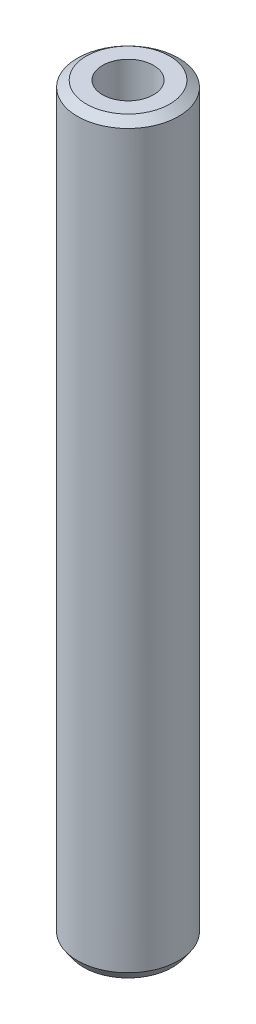
from build123d import *
from OCP.BRepFilletAPI import BRepFilletAPI_MakeChamfer

# Parameters (mm, degrees)
SKETCH1_R           = 5
BOSS_EXTRUDE1_DEPTH = 73.81651233
SKETCH2_R           = 2.522600989
CUT_EXTRUDE1_DEPTH  = 75.154416542
CHAMFER1_SIZE       = 0.613163033
CHAMFER1_SIZE2      = 0.881076496


with BuildPart() as part:
    # Sketch1 → Boss-Extrude1 (new body)
    with BuildSketch(Plane(origin=(0, 0, 0), x_dir=(1, 0, 0), z_dir=(0, 1, 0))):
        Circle(SKETCH1_R)
    extrude(amount=BOSS_EXTRUDE1_DEPTH)

    # Sketch2 → Cut-Extrude1 (cut, through all)
    with BuildSketch(Plane(origin=(0, 0, 0), x_dir=(1, 0, 0), z_dir=(0, 1, 0))):
        Circle(SKETCH2_R)
    extrude(amount=CUT_EXTRUDE1_DEPTH, mode=Mode.SUBTRACT)

    # Chamfer1: one chamfer whose edges measure the first distance from different faces: ONE call of the kernel's chamfer builder (chamfer() names one face for all edges)
    chamfer1_edges_1 = [part.edges().sort_by_distance(p)[0] for p in [
        (-5, 73.81651233, 0),
    ]]
    chamfer1_side_1 = [part.faces().sort_by_distance(p)[0] for p in [
        (-5, 36.908256165, 0),
    ]]
    chamfer1_edges_2 = [part.edges().sort_by_distance(p)[0] for p in [
        (-5, 0, 0),
    ]]
    chamfer1_side_2 = [part.faces().sort_by_distance(p)[0] for p in [
        (-4.858578644, 0, 0),
    ]]
    chamfer1 = BRepFilletAPI_MakeChamfer(part.part.solid().wrapped)
    for e in chamfer1_edges_1:
        chamfer1.Add(CHAMFER1_SIZE, CHAMFER1_SIZE2, e.wrapped, chamfer1_side_1[0].wrapped)  # the first distance lies on this face
    for e in chamfer1_edges_2:
        chamfer1.Add(CHAMFER1_SIZE, CHAMFER1_SIZE2, e.wrapped, chamfer1_side_2[0].wrapped)  # the first distance lies on this face
    add(Compound.cast(chamfer1.Shape()), mode=Mode.REPLACE)


solid = part.part
